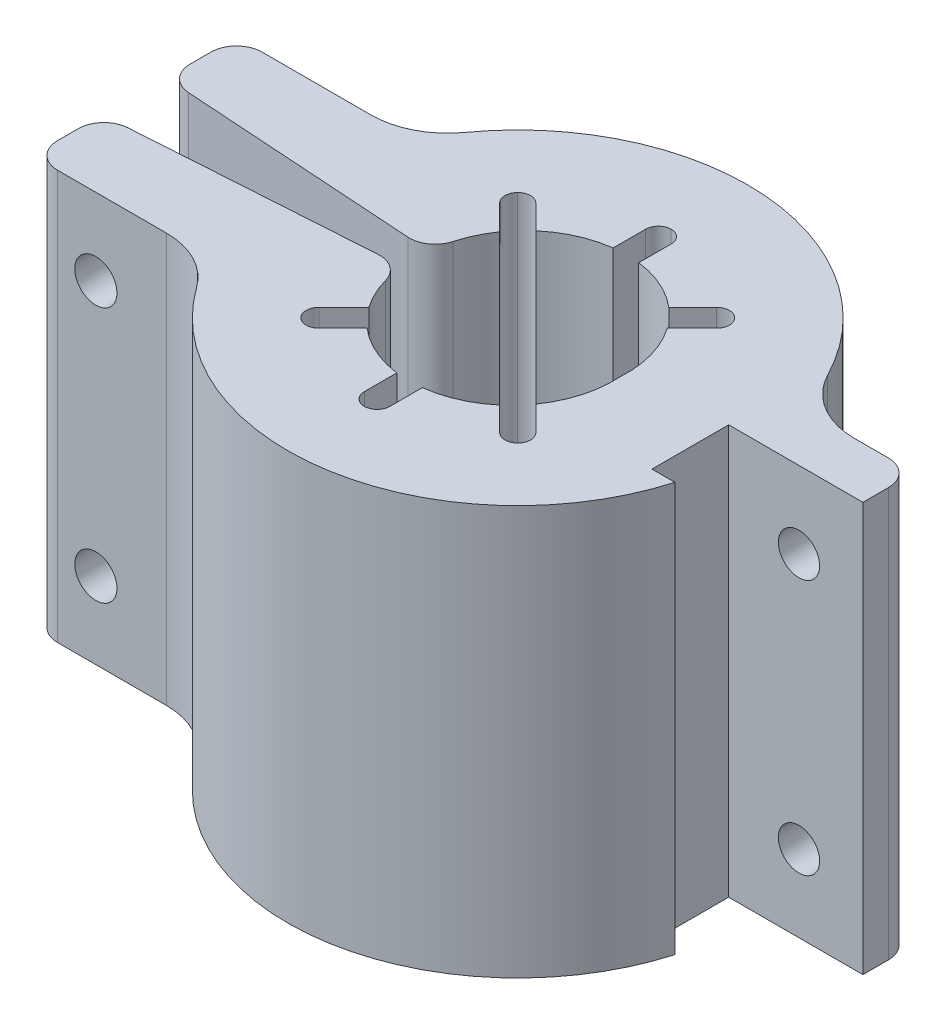
from build123d import *

# Parameters (mm, degrees)
BOSS_EXTRUDE1_DEPTH      = 16
SKETCH2_W                = 1
SKETCH2_H                = 5
CUT_EXTRUDE1_DEPTH       = 24.706539182
FILLET1_R                = 0.5
CIRPATTERN1_COUNT        = 8
FILLET1_OF_CIRPATTERN1_R = 0.5
CUT_EXTRUDE2_DEPTH       = 24.706539182
CUT_EXTRUDE3_DEPTH       = 24.900836805
CUT_EXTRUDE3_DEPTH_BACK  = 24.900836805
SKETCH5_R                = 0.80645
SKETCH5_R_2              = 0.825
FILLET2_R                = 1
FILLET3_R                = 3
CUT_EXTRUDE5_DEPTH       = 10


# Some blends are built 0.0001 mm under size
with BuildPart() as part:
    # Sketch1 → Boss-Extrude1 (new body)
    with BuildSketch(Plane(origin=(0, 0, 0), x_dir=(1, 0, 0), z_dir=(0, 1, 0))):
        with BuildLine():
            Line((-3.98274298, -0.525180459), (-15, -1.25))
            Line((-15, -1.25), (-15, -4))
            Line((-15, -4), (-8.062257748, -4))
            ThreePointArc((-8.062257748, -4), (0.804756356, -8.963948193), (8.645808233, -2.5))
            Line((8.645808233, -2.5), (13, -2.5))
            Line((13, -2.5), (13, 2.5))
            Line((13, 2.5), (8.645808233, 2.5))
            ThreePointArc((8.645808233, 2.5), (0.804756356, 8.963948193), (-8.062257748, 4))
            Line((-8.062257748, 4), (-15, 4))
            Line((-15, 4), (-15, 1.25))
            Line((-15, 1.25), (-3.98274298, 0.525180459))
            ThreePointArc((-3.98274298, 0.525180459), (0.27121874, 4.25396172), (4, 0))
            ThreePointArc((4, 0), (0.27121874, -4.25396172), (-3.98274298, -0.525180459))
        make_face()
    extrude(amount=BOSS_EXTRUDE1_DEPTH)

    # Sketch2 → Cut-Extrude1 (cut, through all)
    with BuildSketch(Plane(origin=(0, 16, 0), x_dir=(1, 0, 0), z_dir=(0, 1, 0))):
        with Locations((0, 3.5)):
            Rectangle(SKETCH2_W, SKETCH2_H)
    cut_extrude1 = extrude(amount=-CUT_EXTRUDE1_DEPTH, mode=Mode.SUBTRACT)

    # Fillet1
    fillet1_edges = [part.edges().sort_by_distance(p)[0] for p in [
        (-0.5, 8, -6),
        (0.5, 8, -6),
    ]]
    fillet(fillet1_edges, radius=FILLET1_R - 0.0001)  # a hair under: the kernel refuses the full size

    # CirPattern1: Cut-Extrude1 ×8 about axis, 2 skipped
    cirpattern1_axis = Axis((0, 0, 0), (0, -1, 0))
    add([cut_extrude1.rotate(cirpattern1_axis, i * 360 / CIRPATTERN1_COUNT) for i in range(1, CIRPATTERN1_COUNT) if i not in (2, 6)], mode=Mode.SUBTRACT)

    # Fillet1 of CirPattern1
    fillet1_of_cirpattern1_edges = [part.edges().sort_by_distance(p)[0] for p in [
        (3.889087297, 8, -4.596194078),
        (4.596194078, 8, -3.889087297),
        (4.596194078, 8, 3.889087297),
        (3.889087297, 8, 4.596194078),
        (0.5, 8, 6),
        (-0.5, 8, 6),
        (-3.889087297, 8, 4.596194078),
        (-4.596194078, 8, 3.889087297),
        (-4.596194078, 8, -3.889087297),
        (-3.889087297, 8, -4.596194078),
    ]]
    fillet(fillet1_of_cirpattern1_edges, radius=FILLET1_OF_CIRPATTERN1_R - 0.0001)  # a hair under: the kernel refuses the full size

    # Sketch4 → Cut-Extrude2 (cut, through all)
    with BuildSketch(Plane(origin=(0, 16, 0), x_dir=(1, 0, 0), z_dir=(0, 1, 0))):
        Polygon((7.75, -0.5), (7.75, 0.5), (13, 0.5), (13, -0.5), (13, -2.5), (7.75, -2.5), align=None)
    extrude(amount=-CUT_EXTRUDE2_DEPTH, mode=Mode.SUBTRACT)

    # Sketch5 → Cut-Extrude3 (cut, two sides: drawn at the far end of the back side and taken through both)
    with BuildSketch(Plane.XY.offset(-0.5).offset(-CUT_EXTRUDE3_DEPTH_BACK)):
        with Locations((10.5, 13)):
            Circle(SKETCH5_R)
        with Locations((10.5, 3)):
            Circle(SKETCH5_R)
        with Locations((-12.5, 13)):
            Circle(SKETCH5_R_2)
        with Locations((-12.5, 3)):
            Circle(SKETCH5_R_2)
    extrude(amount=CUT_EXTRUDE3_DEPTH + CUT_EXTRUDE3_DEPTH_BACK, mode=Mode.SUBTRACT)

    # Fillet2
    fillet2_edges = [part.edges().sort_by_distance(p)[0] for p in [
        (-3.98274298, 8, -0.525180459),
        (-15, 8, -1.25),
        (-15, 8, -4),
        (13, 8, -2.5),
        (-15, 8, 4),
        (-15, 8, 1.25),
        (-3.98274298, 8, 0.525180459),
    ]]
    fillet(fillet2_edges, radius=FILLET2_R)

    # Fillet3
    # the kernel refuses this fillet: 3 mm, written as the material it adds along each edge
    with BuildSketch(Plane(origin=(-8.062257748, 0, -4), x_dir=(-1, 0, 0), z_dir=(0, 1, 0))) as fillet3_piece_1:
        with BuildLine():
            CenterArc((1.684536597, -3), FILLET3_R, 90, 54.314665287)
            ThreePointArc((-0.75216199, -1.25), (-0.350711983, -0.640265285), (0, 0))
            Line((0, 0), (1.684536597, 0))
        make_face()
    extrude(amount=16)
    with BuildSketch(Plane(origin=(8.645808233, 0, -2.5), x_dir=(-0.36980540281703944, 0, -0.9291092314939762), z_dir=(0, 1, 0))) as fillet3_piece_2_section:
        with BuildLine():
            CenterArc((2.040484874, -2.985804583), FILLET3_R, 95.575996261, 62.720387264)
            Line((-0.74684282, -1.876388375), (0, 0))
            ThreePointArc((0, 0), (0.874493518, -0.04258625), (1.748987035, 0))
        make_face()
    fillet3_piece_2 = extrude(amount=16, mode=Mode.PRIVATE)
    fillet3_piece_2 = fillet3_piece_2 - Plane(origin=(10.5, 13, -2.86106774), x_dir=(1, 0, 0), z_dir=(0, 0, 1)) * Cylinder(0.80645, 40, mode=Mode.PRIVATE)
    fillet3_piece_2 = fillet3_piece_2 - Plane(origin=(10.5, 3, -2.86106774), x_dir=(1, 0, 0), z_dir=(0, 0, 1)) * Cylinder(0.80645, 40, mode=Mode.PRIVATE)
    add(fillet3_piece_2)
    with BuildSketch(Plane(origin=(-8.062257748, 0, 4), x_dir=(0.5155850316607751, 0, 0.8568384183306427), z_dir=(0, 1, 0))) as fillet3_piece_3:
        with BuildLine():
            CenterArc((1.701993401, -2.990130768), FILLET3_R, 94.648767376, 54.314665287)
            Line((-0.868521854, -1.443375673), (0, 0))
            ThreePointArc((0, 0), (0.729425743, -0.029607696), (1.458851486, 0))
        make_face()
    extrude(amount=16)

    # Sketch7 → Cut-Extrude5 (cut)
    with BuildSketch(Plane(origin=(0, 0, -2.5), x_dir=(-1, 0, 0), z_dir=(0, 0, -1))):
        Polygon((-10.5, 15.367136104), (-12.55, 14.183568052), (-12.55, 11.816431948), (-10.5, 10.632863896), (-8.45, 11.816431948), (-8.45, 14.183568052), align=None)
        Polygon((-10.5, 5.367136104), (-12.55, 4.183568052), (-12.55, 1.816431948), (-10.5, 0.632863896), (-8.45, 1.816431948), (-8.45, 4.183568052), align=None)
    extrude(amount=CUT_EXTRUDE5_DEPTH, mode=Mode.SUBTRACT)


solid = part.part
